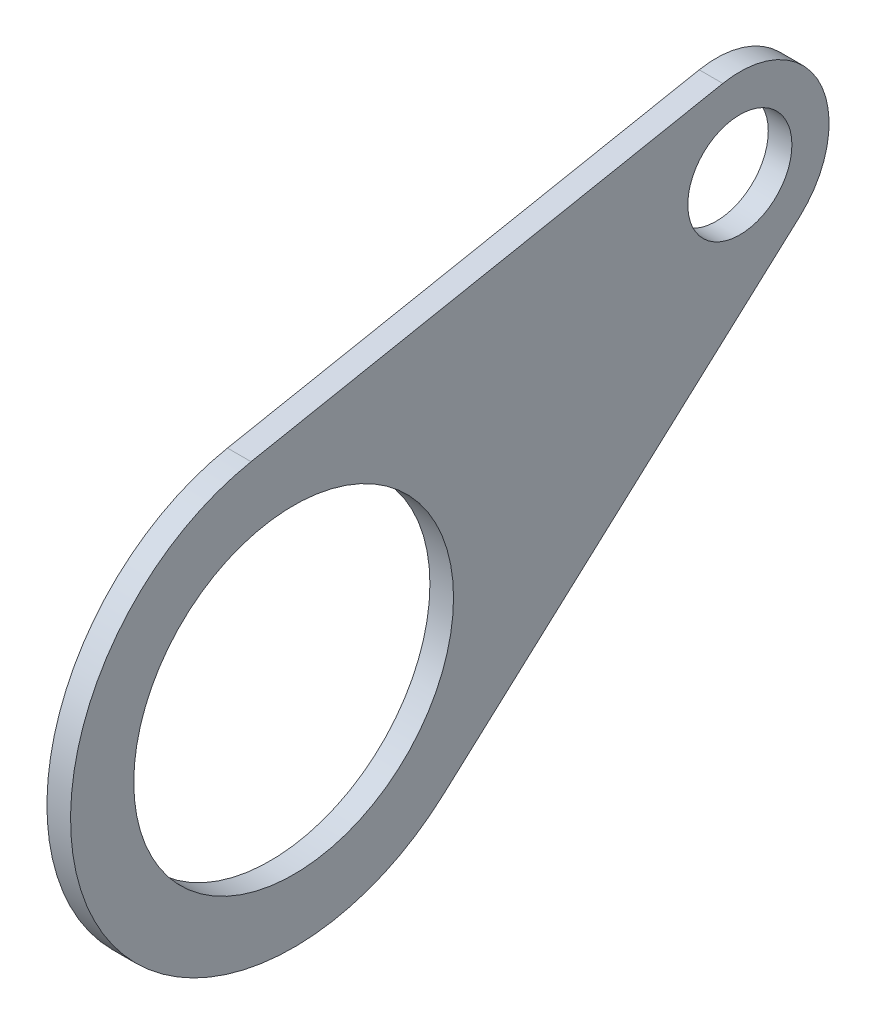
from build123d import *

# Parameters (mm, degrees)
SKETCH1_R           = 21.5
SKETCH1_R_2         = 7
BOSS_EXTRUDE1_DEPTH = 3.175


with BuildPart() as part:
    # Sketch1 → Boss-Extrude1 (new body)
    with BuildSketch(Plane(origin=(0, 0, 0), x_dir=(0, 0, -1), z_dir=(1, 0, 0))):
        with BuildLine():
            Line((-5.724395537, 29.448791074), (57.710241785, 41.77951643))
            ThreePointArc((57.710241785, 41.77951643), (70.733126292, 35.366563146), (68.049758215, 21.10048357))
            Line((68.049758215, 21.10048357), (20.124395537, -22.248791074))
            ThreePointArc((20.124395537, -22.248791074), (-26.83281573, -13.416407865), (-5.724395537, 29.448791074))
        make_face()
        Circle(SKETCH1_R, mode=Mode.SUBTRACT)
        with Locations((60, 30)):
            Circle(SKETCH1_R_2, mode=Mode.SUBTRACT)
    extrude(amount=BOSS_EXTRUDE1_DEPTH)


solid = part.part
